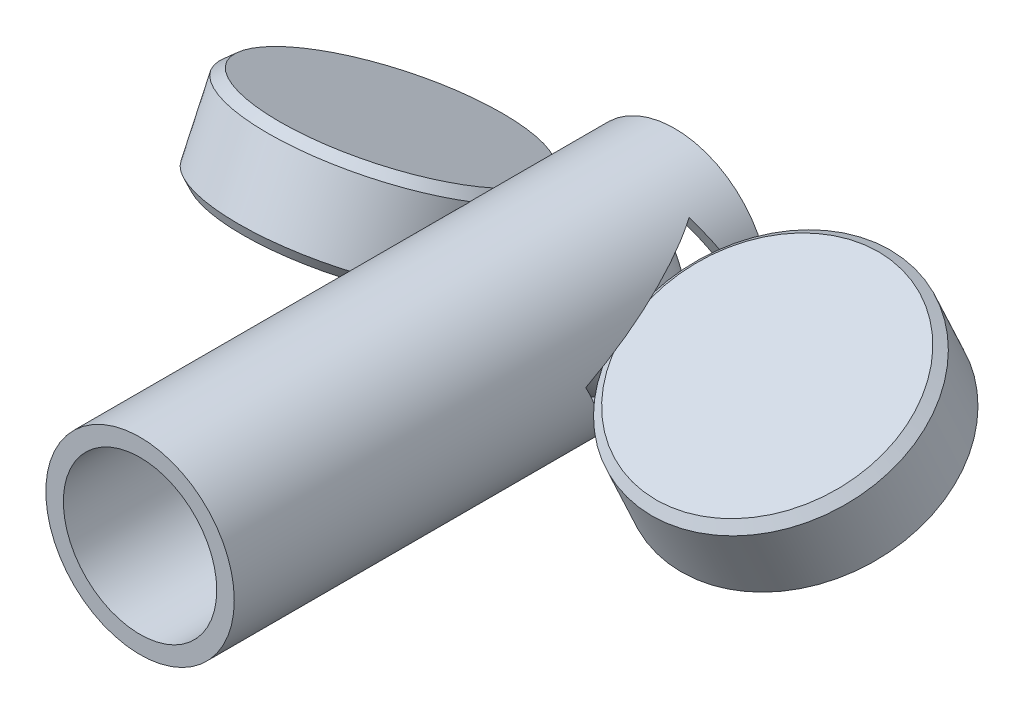
from build123d import *

# Parameters (mm, degrees)
CHAMFER1_SIZE            = 1
CIRPATTERN1_COUNT        = 2
BOSS_EXTRUDE2_DEPTH      = 50
BOSS_EXTRUDE2_DEPTH_BACK = 11
SKETCH9_R                = 10.75
SKETCH9_R_2              = 8.75
CUT_EXTRUDE1_DEPTH       = 11
CIRPATTERN2_START        = -8.541476068
CIRPATTERN2_OUTLINE_W    = 10
CIRPATTERN2_OUTLINE_H    = 10
CIRPATTERN2_DEPTH        = 17.082952136


# Read off the part's stored shape, not the designer's step: CirPattern2
with BuildPart() as part:
    # Sketch4 → Revolve4 (revolve)
    with BuildSketch(Plane.XY):
        with BuildLine():
            Line((0, 8.5), (0, -8.5))
            ThreePointArc((0, -8.5), (-8.5, 0), (0, 8.5))
        make_face()
    revolve(axis=Axis((0, 8.5, 0), (0, -1, 0)))


with BuildPart() as body_2:
    # Sketch7 → Revolve5 (revolve)
    with BuildSketch(Plane.ZY.offset(23.5), mode=Mode.PRIVATE) as revolve5_sk:
        Polygon((2.113091309, -4.531538935), (-11.481525497, -10.870812861), (-15.707708114, -1.807734991), (-2.113091309, 4.531538935), align=None)
    revolve(revolve5_sk.sketch.rotate(Axis((-23.5, 4.531538935, -2.113091309), (-2.7755575615628933e-15, -0.9063077870366493, 0.42261826174070116)), 180), axis=Axis((-23.5, 4.531538935, -2.113091309), (-2.7755575615628933e-15, -0.9063077870366493, 0.42261826174070116)))

    # Chamfer1
    chamfer1_edges = [body_2.edges().sort_by_distance(p)[0] for p in [
        (-23.5, -1.807734991, -15.707708114),
        (-23.5, -10.870812861, -11.481525497),
    ]]
    chamfer(chamfer1_edges, length=CHAMFER1_SIZE)


with BuildPart() as cirpattern1_1:
    # CirPattern1: pattern copy
    add(body_2.part.rotate(Axis((0, 0.119054888, -0.083338421), (0, 1, 0)), 1 * 360 / CIRPATTERN1_COUNT))


with BuildPart() as body_4:
    # Sketch9 → Boss-Extrude2 (new, two sides: drawn at the far end of the back side and taken through both)
    with BuildSketch(Plane.XY.offset(-BOSS_EXTRUDE2_DEPTH_BACK)):
        Circle(SKETCH9_R)
        Circle(SKETCH9_R_2, mode=Mode.SUBTRACT)
    extrude(amount=BOSS_EXTRUDE2_DEPTH + BOSS_EXTRUDE2_DEPTH_BACK)

    # Sketch11 → Cut-Extrude1 (cut)
    with BuildSketch(Plane(origin=(0, 0, 0), x_dir=(0, 0, -1), z_dir=(1, 0, 0))):
        Polygon((9.854297582, 0.921755167), (-5.628114964, 8.141322704), (-9.854297582, -0.921755167), (5.628114964, -8.141322704), align=None)
    extrude(amount=-CUT_EXTRUDE1_DEPTH, mode=Mode.SUBTRACT)

    # CirPattern2 outline → CirPattern2 (cut)
    with BuildSketch(Plane(origin=(0, 0, 0), x_dir=(1, 0, 0), z_dir=(0, 0.4226182617407011, -0.9063077870366493)).offset(CIRPATTERN2_START)):
        with Locations((7, 0)):
            Rectangle(CIRPATTERN2_OUTLINE_W, CIRPATTERN2_OUTLINE_H)
    extrude(amount=CIRPATTERN2_DEPTH, mode=Mode.SUBTRACT)


solid = Compound([part.part, body_2.part, cirpattern1_1.part, body_4.part])
